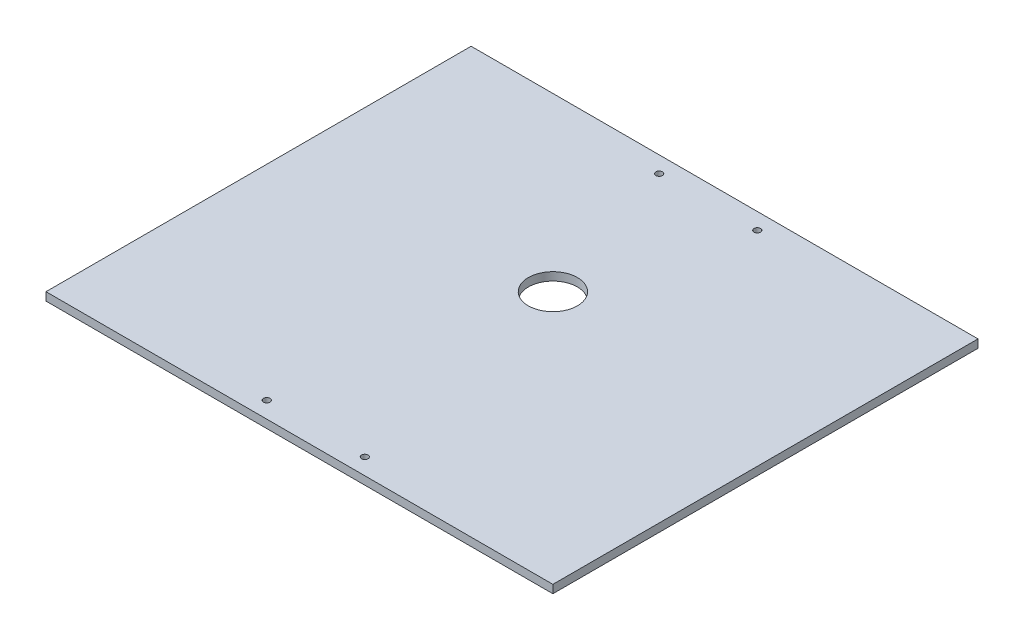
from build123d import *

# Parameters (mm, degrees)
SKETCH2_W           = 120
SKETCH2_H           = 260
BOSS_EXTRUDE1_DEPTH = 5
SKETCH3_R           = 15
CUT_EXTRUDE1_DEPTH  = 144.265487819
SKETCH5_R           = 2
CUT_EXTRUDE2_DEPTH  = 144.265487819
SKETCH6_W           = 95
SKETCH6_H           = 260
BOSS_EXTRUDE2_DEPTH = 5


with BuildPart() as part:
    # Sketch2 → Boss-Extrude1 (new body)
    with BuildSketch(Plane(origin=(0, 0, 0), x_dir=(1, 0, 0), z_dir=(0, 1, 0))):
        Rectangle(SKETCH2_W, SKETCH2_H)
    extrude(amount=BOSS_EXTRUDE1_DEPTH)

    # Sketch3 → Cut-Extrude1 (cut, through all)
    with BuildSketch(Plane(origin=(0, 5, 0), x_dir=(1, 0, 0), z_dir=(0, 1, 0))):
        with Locations((0, 25)):
            Circle(SKETCH3_R)
    extrude(amount=-CUT_EXTRUDE1_DEPTH, mode=Mode.SUBTRACT)

    # Sketch5 → Cut-Extrude2 (cut, through all)
    with BuildSketch(Plane(origin=(0, 5, 0), x_dir=(1, 0, 0), z_dir=(0, 1, 0))):
        with Locations((-30, 120)):
            Circle(SKETCH5_R)
        with Locations((30, 120)):
            Circle(SKETCH5_R)
        with Locations((30, -120)):
            Circle(SKETCH5_R)
        with Locations((-30, -120)):
            Circle(SKETCH5_R)
    extrude(amount=-CUT_EXTRUDE2_DEPTH, mode=Mode.SUBTRACT)

    # Sketch6 → Boss-Extrude2 (add)
    with BuildSketch(Plane(origin=(0, 5, 0), x_dir=(1, 0, 0), z_dir=(0, 1, 0))):
        with Locations((107.5, 0)):
            Rectangle(SKETCH6_W, SKETCH6_H)
        with Locations((-107.5, 0)):
            Rectangle(SKETCH6_W, SKETCH6_H)
    extrude(amount=-BOSS_EXTRUDE2_DEPTH)


solid = part.part
